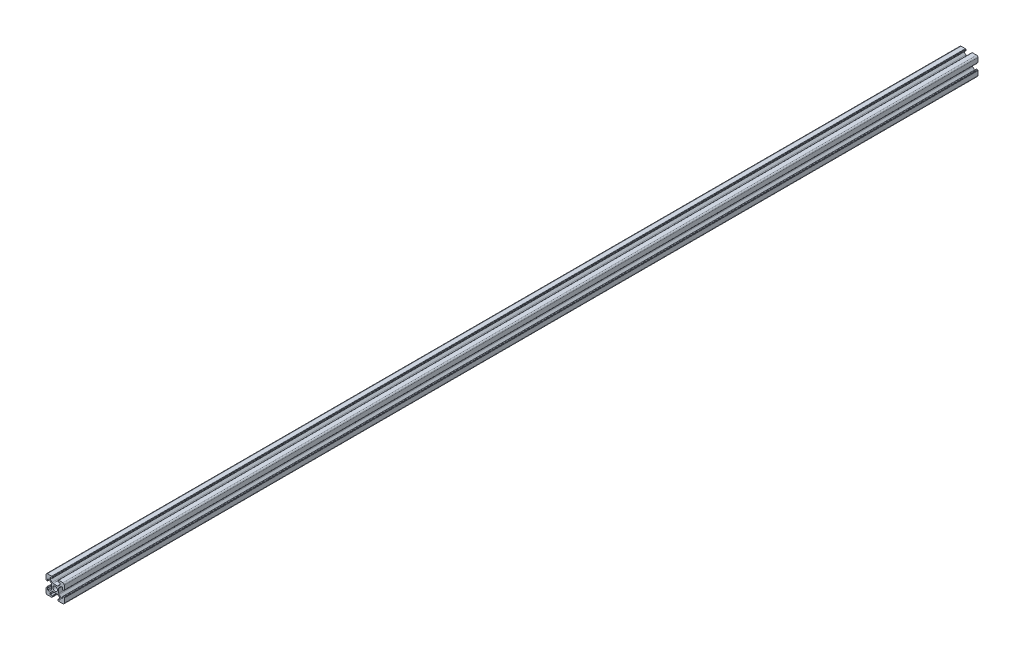
from build123d import *

# Parameters (mm, degrees)
BOSS_EXTRUDE1_DEPTH = 1000
F_3DSKETCH2_R       = 2.5
CUT_EXTRUDE1_DEPTH  = 1001.100029035


with BuildPart() as part:
    # Sketch1 → Boss-Extrude1 (new body)
    with BuildSketch(Plane.XY):
        with BuildLine():
            ThreePointArc((-4.339541497, 3.27832502), (-4.01438237, 2.791689997), (-3.900201668, 2.217664848))
            Line((-3.900201668, 2.217664848), (-3.900201668, -2.220777458))
            ThreePointArc((-3.900201668, -2.220777458), (-4.013982246, -2.793835668), (-4.338062619, -3.279956687))
            ThreePointArc((-4.338062619, -3.279956687), (-4.338801799, -3.280697416), (-4.339541497, -3.28143763))
            Line((-4.339541497, -3.28143763), (-6.559305445, -5.501201578))
            Line((-6.559305445, -5.501201578), (-7.918645273, -5.501201578))
            ThreePointArc((-7.918645273, -5.501201578), (-8.116635172, -5.419191476), (-8.198645273, -5.221201578))
            Line((-8.198645273, -5.221201578), (-8.198645273, -3.381201578))
            ThreePointArc((-8.198645273, -3.381201578), (-8.280655374, -3.183211679), (-8.478645273, -3.101201578))
            Line((-8.478645273, -3.101201578), (-9.418645273, -3.101201578))
            ThreePointArc((-9.418645273, -3.101201578), (-9.616635172, -3.183211679), (-9.698645273, -3.381201578))
            Line((-9.698645273, -3.381201578), (-9.698645273, -3.601201578))
            Line((-9.698645273, -3.601201578), (-9.718645273, -3.601201578))
            ThreePointArc((-9.718645273, -3.601201578), (-9.916635172, -3.683211679), (-9.998645273, -3.881201578))
            Line((-9.998645273, -3.881201578), (-9.998645273, -8.501201578))
            ThreePointArc((-9.998645273, -8.501201578), (-9.559305445, -9.561861749), (-8.498645273, -10.001201578))
            Line((-8.498645273, -10.001201578), (-3.878645273, -10.001201578))
            ThreePointArc((-3.878645273, -10.001201578), (-3.680655374, -9.919191476), (-3.598645273, -9.721201578))
            Line((-3.598645273, -9.721201578), (-3.598645273, -9.701201578))
            Line((-3.598645273, -9.701201578), (-3.378645273, -9.701201578))
            ThreePointArc((-3.378645273, -9.701201578), (-3.180655374, -9.619191476), (-3.098645273, -9.421201578))
            Line((-3.098645273, -9.421201578), (-3.098645273, -8.481201578))
            ThreePointArc((-3.098645273, -8.481201578), (-3.180655374, -8.283211679), (-3.378645273, -8.201201578))
            Line((-3.378645273, -8.201201578), (-5.218645273, -8.201201578))
            ThreePointArc((-5.218645273, -8.201201578), (-5.416635172, -8.119191476), (-5.498645273, -7.921201578))
            Line((-5.498645273, -7.921201578), (-5.498645273, -6.561861749))
            Line((-5.498645273, -6.561861749), (-3.277324929, -4.340541406))
            ThreePointArc((-3.277324929, -4.340541406), (-2.790689906, -4.015382279), (-2.216664757, -3.901201578))
            Line((-2.216664757, -3.901201578), (2.234977304, -3.899793498))
            ThreePointArc((2.234977304, -3.899793498), (2.801097117, -4.016727825), (3.280957809, -4.339061494))
            Line((3.280957809, -4.339061494), (5.502201668, -6.560305354))
            Line((5.502201668, -6.560305354), (5.502201668, -7.919645182))
            ThreePointArc((5.502201668, -7.919645182), (5.420191567, -8.117635081), (5.222201668, -8.199645182))
            Line((5.222201668, -8.199645182), (3.382201668, -8.199645182))
            ThreePointArc((3.382201668, -8.199645182), (3.18421177, -8.281655283), (3.102201668, -8.479645182))
            Line((3.102201668, -8.479645182), (3.102201668, -9.419645182))
            ThreePointArc((3.102201668, -9.419645182), (3.18421177, -9.617635081), (3.382201668, -9.699645182))
            Line((3.382201668, -9.699645182), (3.602201668, -9.699645182))
            Line((3.602201668, -9.699645182), (3.602201668, -9.719645182))
            ThreePointArc((3.602201668, -9.719645182), (3.68421177, -9.917635081), (3.882201668, -9.999645182))
            Line((3.882201668, -9.999645182), (8.502201668, -9.999645182))
            ThreePointArc((8.502201668, -9.999645182), (9.56286184, -9.560305354), (10.002201668, -8.499645182))
            Line((10.002201668, -8.499645182), (10.002201668, -3.879645182))
            ThreePointArc((10.002201668, -3.879645182), (9.920191567, -3.681655283), (9.722201668, -3.599645182))
            Line((9.722201668, -3.599645182), (9.702201668, -3.599645182))
            Line((9.702201668, -3.599645182), (9.702201668, -3.379645182))
            ThreePointArc((9.702201668, -3.379645182), (9.620191567, -3.181655283), (9.422201668, -3.099645182))
            Line((9.422201668, -3.099645182), (8.482201668, -3.099645182))
            ThreePointArc((8.482201668, -3.099645182), (8.28421177, -3.181655283), (8.202201668, -3.379645182))
            Line((8.202201668, -3.379645182), (8.202201668, -5.219645182))
            ThreePointArc((8.202201668, -5.219645182), (8.120191567, -5.417635081), (7.922201668, -5.499645182))
            Line((7.922201668, -5.499645182), (6.56286184, -5.499645182))
            Line((6.56286184, -5.499645182), (4.341541497, -3.278324838))
            ThreePointArc((4.341541497, -3.278324838), (4.01638237, -2.791689815), (3.902201668, -2.217664667))
            Line((3.902201668, -2.217664667), (3.900793589, 2.233977395))
            ThreePointArc((3.900793589, 2.233977395), (4.017727916, 2.800097207), (4.340061585, 3.2799579))
            Line((4.340061585, 3.2799579), (6.561305445, 5.501201759))
            Line((6.561305445, 5.501201759), (7.920645273, 5.501201759))
            ThreePointArc((7.920645273, 5.501201759), (8.118635172, 5.419191658), (8.200645273, 5.221201759))
            Line((8.200645273, 5.221201759), (8.200645273, 3.381201759))
            ThreePointArc((8.200645273, 3.381201759), (8.282655374, 3.183211861), (8.480645273, 3.101201759))
            Line((8.480645273, 3.101201759), (9.420645273, 3.101201759))
            ThreePointArc((9.420645273, 3.101201759), (9.618635172, 3.183211861), (9.700645273, 3.381201759))
            Line((9.700645273, 3.381201759), (9.700645273, 3.601201759))
            Line((9.700645273, 3.601201759), (9.720645273, 3.601201759))
            ThreePointArc((9.720645273, 3.601201759), (9.918635172, 3.683211861), (10.000645273, 3.881201759))
            Line((10.000645273, 3.881201759), (10.000645273, 8.501201759))
            ThreePointArc((10.000645273, 8.501201759), (9.561305445, 9.561861931), (8.500645273, 10.001201759))
            Line((8.500645273, 10.001201759), (3.880645273, 10.001201759))
            ThreePointArc((3.880645273, 10.001201759), (3.682655374, 9.919191658), (3.600645273, 9.721201759))
            Line((3.600645273, 9.721201759), (3.600645273, 9.701201759))
            Line((3.600645273, 9.701201759), (3.380645273, 9.701201759))
            ThreePointArc((3.380645273, 9.701201759), (3.182655374, 9.619191658), (3.100645273, 9.421201759))
            Line((3.100645273, 9.421201759), (3.100645273, 8.481201759))
            ThreePointArc((3.100645273, 8.481201759), (3.182655374, 8.283211861), (3.380645273, 8.201201759))
            Line((3.380645273, 8.201201759), (5.220645273, 8.201201759))
            ThreePointArc((5.220645273, 8.201201759), (5.418635172, 8.119191658), (5.500645273, 7.921201759))
            Line((5.500645273, 7.921201759), (5.500645273, 6.561861931))
            Line((5.500645273, 6.561861931), (3.279324929, 4.340541588))
            ThreePointArc((3.279324929, 4.340541588), (2.792689906, 4.015382461), (2.218664757, 3.901201759))
            Line((2.218664757, 3.901201759), (-2.232977304, 3.89979368))
            ThreePointArc((-2.232977304, 3.89979368), (-2.799097117, 4.016728006), (-3.278957809, 4.339061676))
            Line((-3.278957809, 4.339061676), (-5.500201668, 6.560305535))
            Line((-5.500201668, 6.560305535), (-5.500201668, 7.919645364))
            ThreePointArc((-5.500201668, 7.919645364), (-5.418191567, 8.117635262), (-5.220201668, 8.199645364))
            Line((-5.220201668, 8.199645364), (-3.380201668, 8.199645364))
            ThreePointArc((-3.380201668, 8.199645364), (-3.18221177, 8.281655465), (-3.100201668, 8.479645364))
            Line((-3.100201668, 8.479645364), (-3.100201668, 9.419645364))
            ThreePointArc((-3.100201668, 9.419645364), (-3.18221177, 9.617635262), (-3.380201668, 9.699645364))
            Line((-3.380201668, 9.699645364), (-3.600201668, 9.699645364))
            Line((-3.600201668, 9.699645364), (-3.600201668, 9.719645364))
            ThreePointArc((-3.600201668, 9.719645364), (-3.68221177, 9.917635262), (-3.880201668, 9.999645364))
            Line((-3.880201668, 9.999645364), (-8.500201668, 9.999645364))
            ThreePointArc((-8.500201668, 9.999645364), (-9.56086184, 9.560305535), (-10.000201668, 8.499645364))
            Line((-10.000201668, 8.499645364), (-10.000201668, 3.879645364))
            ThreePointArc((-10.000201668, 3.879645364), (-9.918191567, 3.681655465), (-9.720201668, 3.599645364))
            Line((-9.720201668, 3.599645364), (-9.700201668, 3.599645364))
            Line((-9.700201668, 3.599645364), (-9.700201668, 3.379645364))
            ThreePointArc((-9.700201668, 3.379645364), (-9.618191567, 3.181655465), (-9.420201668, 3.099645364))
            Line((-9.420201668, 3.099645364), (-8.480201668, 3.099645364))
            ThreePointArc((-8.480201668, 3.099645364), (-8.28221177, 3.181655465), (-8.200201668, 3.379645364))
            Line((-8.200201668, 3.379645364), (-8.200201668, 5.219645364))
            ThreePointArc((-8.200201668, 5.219645364), (-8.118191567, 5.417635262), (-7.920201668, 5.499645364))
            Line((-7.920201668, 5.499645364), (-6.56086184, 5.499645364))
            Line((-6.56086184, 5.499645364), (-4.339541497, 3.27832502))
        make_face()
    extrude(amount=BOSS_EXTRUDE1_DEPTH)

    # 3DSketch2 → Cut-Extrude1 (cut, through all)
    with BuildSketch(Plane.XY):
        Circle(F_3DSKETCH2_R)
    extrude(amount=CUT_EXTRUDE1_DEPTH, mode=Mode.SUBTRACT)


solid = part.part
